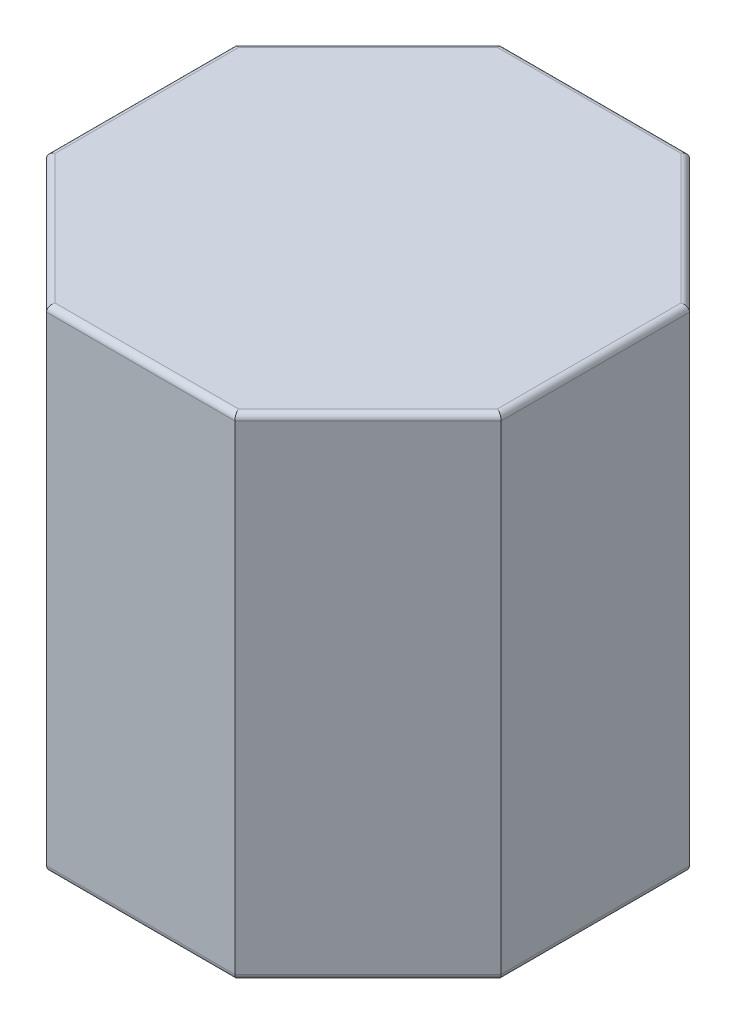
from build123d import *

# Parameters (mm, degrees)
BOSS_EXTRUDE1_DEPTH = 40
FILLET1_R           = 0.5


with BuildPart() as part:
    # Sketch1 → Boss-Extrude1 (new body)
    with BuildSketch(Plane(origin=(0, 0, 0), x_dir=(1, 0, 0), z_dir=(0, 1, 0))):
        Polygon((-7.662950904, 18.5), (-18.5, 7.662950904), (-18.5, -7.662950904), (-7.662950904, -18.5), (7.662950904, -18.5), (18.5, -7.662950904), (18.5, 7.662950904), (7.662950904, 18.5), align=None)
    extrude(amount=BOSS_EXTRUDE1_DEPTH)

    # Fillet1
    fillet1_edges = [part.edges().sort_by_distance(p)[0] for p in [
        (-13.081475452, 0, -13.081475452),
        (-18.5, 0, 0),
        (-13.081475452, 0, 13.081475452),
        (0, 0, 18.5),
        (13.081475452, 0, 13.081475452),
        (18.5, 0, 0),
        (13.081475452, 0, -13.081475452),
        (0, 0, -18.5),
        (13.081475452, 40, -13.081475452),
        (18.5, 40, 0),
        (13.081475452, 40, 13.081475452),
        (0, 40, 18.5),
        (-13.081475452, 40, 13.081475452),
        (-18.5, 40, 0),
        (-13.081475452, 40, -13.081475452),
        (0, 40, -18.5),
    ]]
    fillet(fillet1_edges, radius=FILLET1_R)


solid = part.part
